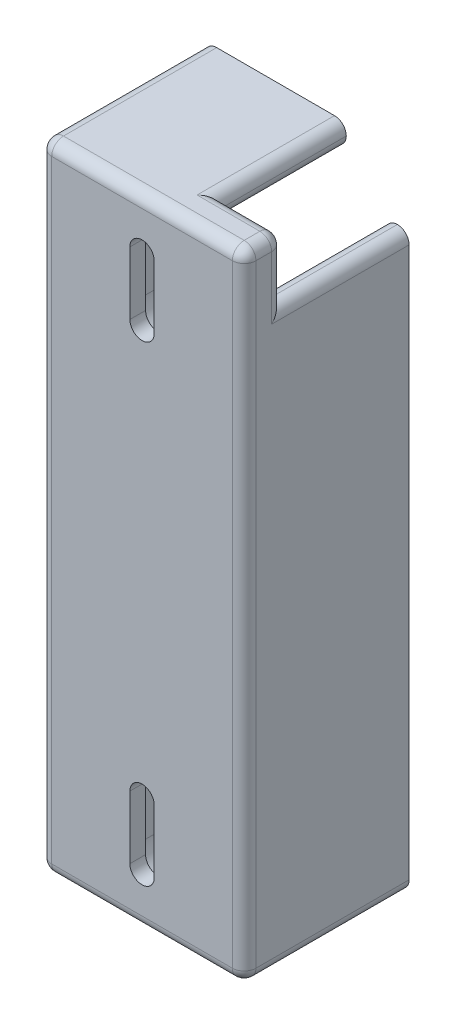
from build123d import *

# Parameters (mm, degrees)
SKETCH1_W           = 26
SKETCH1_H           = 81
SKETCH1_W_2         = 20
SKETCH1_H_2         = 75
BOSS_EXTRUDE5_DEPTH = 16
SKETCH7_W           = 26
SKETCH7_H           = 81
BOSS_EXTRUDE6_DEPTH = 5
CUT_EXTRUDE3_DEPTH  = 3
SKETCH9_W           = 8
SKETCH9_H           = 16
CUT_EXTRUDE4_DEPTH  = 8
FILLET3_R           = 1.5


with BuildPart() as part:
    # Sketch1 → Boss-Extrude5 (new body)
    with BuildSketch(Plane.XY):
        with Locations((0.5, -22.5)):
            Rectangle(SKETCH1_W, SKETCH1_H)
        with Locations((0.5, -22.5)):
            Rectangle(SKETCH1_W_2, SKETCH1_H_2, mode=Mode.SUBTRACT)
    extrude(amount=BOSS_EXTRUDE5_DEPTH)

    # Sketch7 → Boss-Extrude6 (add)
    with BuildSketch(Plane.XY.offset(16)):
        with Locations((0.5, -22.5)):
            Rectangle(SKETCH7_W, SKETCH7_H)
        with BuildLine():
            Line((2.05, 11.5), (2.05, 3.5))
            ThreePointArc((2.05, 3.5), (0.5, 1.95), (-1.05, 3.5))
            Line((-1.05, 3.5), (-1.05, 11.5))
            ThreePointArc((-1.05, 11.5), (0.5, 13.05), (2.05, 11.5))
        make_face(mode=Mode.SUBTRACT)
        with BuildLine():
            Line((2.05, -56.5), (2.05, -48.5))
            ThreePointArc((2.05, -48.5), (0.5, -46.95), (-1.05, -48.5))
            Line((-1.05, -48.5), (-1.05, -56.5))
            ThreePointArc((-1.05, -56.5), (0.5, -58.05), (2.05, -56.5))
        make_face(mode=Mode.SUBTRACT)
    extrude(amount=BOSS_EXTRUDE6_DEPTH)

    # Sketch8 → Cut-Extrude3 (cut)
    with BuildSketch(Plane(origin=(0, 0, 16), x_dir=(-1, 0, 0), z_dir=(0, 0, -1))):
        with BuildLine():
            Line((2.75, 11.5), (2.75, 3.5))
            ThreePointArc((2.75, 3.5), (-0.5, 0.25), (-3.75, 3.5))
            Line((-3.75, 3.5), (-3.75, 11.5))
            ThreePointArc((-3.75, 11.5), (-0.5, 14.75), (2.75, 11.5))
        make_face()
        with BuildLine():
            Line((2.75, -56.5), (2.75, -48.5))
            ThreePointArc((2.75, -48.5), (-0.5, -45.25), (-3.75, -48.5))
            Line((-3.75, -48.5), (-3.75, -56.5))
            ThreePointArc((-3.75, -56.5), (-0.5, -59.75), (2.75, -56.5))
        make_face()
    extrude(amount=-CUT_EXTRUDE3_DEPTH, mode=Mode.SUBTRACT)

    # Sketch9 → Cut-Extrude4 (cut)
    with BuildSketch(Plane(origin=(0, 18, 0), x_dir=(1, 0, 0), z_dir=(0, 1, 0))):
        with Locations((9.5, -8)):
            Rectangle(SKETCH9_W, SKETCH9_H)
    extrude(amount=-CUT_EXTRUDE4_DEPTH, mode=Mode.SUBTRACT)

    # Fillet3
    fillet3_edges = [part.edges().sort_by_distance(p)[0] for p in [
        (-12.5, -63, 10.5),
        (0.5, -63, 21),
        (13.5, -63, 10.5),
        (13.5, -22.5, 21),
        (9.5, 18, 16),
        (13.5, 14, 16),
        (-12.5, -22.5, 21),
        (10.5, 10, 8),
        (5.5, 15, 8),
        (5.5, 18, 8),
        (13.5, 10, 8),
        (13.5, 18, 18.5),
        (-12.5, 18, 10.5),
        (0.5, 18, 21),
    ]]
    fillet(fillet3_edges, radius=FILLET3_R - 0.0001)  # a hair under: the kernel refuses the full size


solid = part.part
